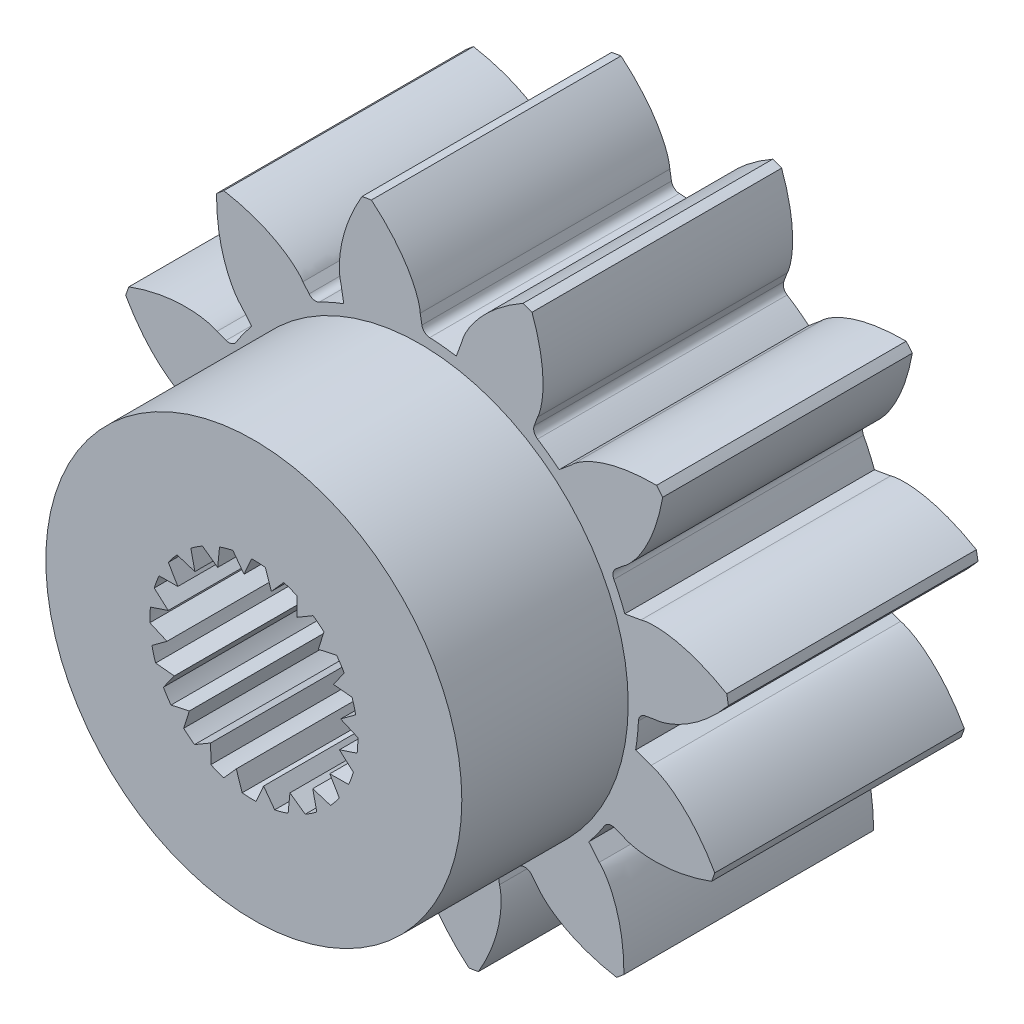
from build123d import *

# Parameters (mm, degrees)
EXTRUDE_9_DEPTH           = 6000
PATTERN_CIRCULAR_4_COUNT  = 12
EXTRUDE_START             = 6000
SKETCH_9_R                = 5000
EXTRUDE_10_DEPTH          = 4000
SKETCH_10_R               = 2500
CUT_EXTRUDE_1_DEPTH       = 10000
EXTRUDE_START_2           = -4000
EXTRUDE_12_DEPTH          = 4000
PATTERN_CIRCULAR_12_COUNT = 20
SKETCH_13_R               = 2500
SKETCH_13_R_2             = 2100
EXTRUDE_13_DEPTH          = 5900
CHAMFER_1_SIZE            = 300


# Read off the part's stored shape, not the designer's step: Бобышка-Вытянуть9
with BuildPart() as part:
    # Бобышка-Вытянуть9 outline → Бобышка-Вытянуть9 (new body)
    with BuildSketch(Plane.XY):
        with BuildLine():
            add(Edge.make_bspline(
                [(5306.192417158, 1906.075026917), (5306.448580551, 1906.165106677), (5306.961668043, 1906.343045565), (5307.99095597, 1906.689845813), (5309.540653432, 1907.192756156), (5311.35337996, 1907.764472804), (5313.95030191, 1908.557747546), (5317.075672181, 1909.479520657), (5320.732777531, 1910.517481963), (5324.924404144, 1911.660215288), (5330.176875618, 1913.040248187), (5336.497938088, 1914.626133361), (5343.894701326, 1916.385727655), (5354.493313319, 1918.761489582), (5366.84000177, 1921.325908382), (5380.945300766, 1924.011039783), (5396.817695636, 1926.748331933), (5412.310969574, 1929.177307208), (5431.718484076, 1931.939359671), (5455.063047063, 1934.843051928), (5485.54471569, 1938.012075463), (5523.195772467, 1940.977861267), (5564.106071411, 1943.156521557), (5608.256997573, 1944.372699431), (5655.937520247, 1944.553223722), (5707.122011738, 1943.489403178), (5761.774342778, 1940.978314208), (5819.848804198, 1936.820805302), (5878.747000314, 1931.176108416), (5938.436248204, 1924.046976876), (5998.884524053, 1915.433286394), (6060.060303893, 1905.332502915), (6127.233340835, 1892.775121857), (6200.296421572, 1877.359660373), (6279.119057582, 1858.67641542), (6363.546359574, 1836.31306456), (6468.344160246, 1805.717375371), (6592.868774888, 1764.968440904), (6736.245826141, 1711.921099134), (6897.34605834, 1644.321879311), (7076.89108329, 1560.25767422), (7213.770397327, 1488.402120254), (7310.317193117, 1433.860426855), (7368.222257541, 1399.750250391)],
                knots=[0, 0, 0, 0, 0, 8.7564e-05, 0.000175127, 0.000350254, 0.000525382, 0.000700509, 0.001050763, 0.001401018, 0.001751272, 0.002101527, 0.002802036, 0.003502545, 0.004203053, 0.005604071, 0.006868344, 0.008132617, 0.009396889, 0.010661162, 0.013189707, 0.015718253, 0.01927867, 0.022839087, 0.026399504, 0.029959921, 0.034653359, 0.039346797, 0.044040235, 0.048733673, 0.053732022, 0.058730371, 0.06372872, 0.068727069, 0.075767527, 0.082807984, 0.089848442, 0.096888899, 0.110969736, 0.125050573, 0.139131407, 0.153212241, 0.174884347, 0.174884347, 0.174884347, 0.174884347, 0.174884347], degree=4))
            Line((5306.192417158, 1906.075026917), (4917.600461427, 1838.397590776))
            ThreePointArc((4917.600461427, 1838.397590776), (-5185.300519011, -821.680307387), (5245.047242409, -227.98996666))
            ThreePointArc((5245.047242409, -227.98996666), (5294.616532272, -104.66268068), (5410.542973109, -39.641189774))
            Line((5410.542973109, -39.641189774), (5638.155724715, 0))
            add(Edge.make_bspline(
                [(5638.155724715, 0), (5638.427258725, 0.001824374), (5638.970291941, 0.007820179), (5640.056219216, 0.029407231), (5641.684691046, 0.080008988), (5643.583966466, 0.154777094), (5646.296166958, 0.286142684), (5649.549142867, 0.475226629), (5653.341825766, 0.734725451), (5657.672978362, 1.076325081), (5663.082738582, 1.553233618), (5669.567765186, 2.197665524), (5677.123882793, 3.042275006), (5687.901636732, 4.389435333), (5700.388322575, 6.150013689), (5714.57088446, 8.391515148), (5730.434132989, 11.181323979), (5745.836350671, 14.133128286), (5765.034948723, 18.094742328), (5787.986673493, 23.254042658), (5817.744985206, 30.57645458), (5854.181857875, 40.513872355), (5893.419973814, 52.29391386), (5935.382531686, 66.075318232), (5980.316750085, 82.024639483), (6028.127958575, 100.32961766), (6078.713553314, 121.169014503), (6131.963189822, 144.714803114), (6185.485291832, 169.938694667), (6239.250031536, 196.827048926), (6293.227228599, 225.369156664), (6347.38635844, 255.556745517), (6406.359144055, 290.083767801), (6469.908956496, 329.291822564), (6537.774483018, 373.522376477), (6609.670561245, 423.111112284), (6697.954681171, 487.334078514), (6801.371661487, 567.781474334), (6918.373397688, 666.1765607), (7047.135298068, 784.258364319), (7187.689728744, 924.071305705), (7292.217863478, 1037.970543174), (7364.641424647, 1121.940227487), (7407.605626076, 1173.617863076)],
                knots=[0, 0, 0, 0, 0, 8.7564e-05, 0.000175127, 0.000350254, 0.000525382, 0.000700509, 0.001050763, 0.001401018, 0.001751272, 0.002101527, 0.002802036, 0.003502545, 0.004203053, 0.005604071, 0.006868344, 0.008132617, 0.009396889, 0.010661162, 0.013189707, 0.015718253, 0.01927867, 0.022839087, 0.026399504, 0.029959921, 0.034653359, 0.039346797, 0.044040235, 0.048733673, 0.053732022, 0.058730371, 0.06372872, 0.068727069, 0.075767527, 0.082807984, 0.089848442, 0.096888899, 0.110969736, 0.125050573, 0.139131407, 0.153212241, 0.174884347, 0.174884347, 0.174884347, 0.174884347, 0.174884347], degree=4))
            ThreePointArc((7407.605626076, 1173.617863076), (7388.779085594, 1286.834730757), (7368.222257541, 1399.750250391))
        make_face()
    extrude_9 = extrude(amount=EXTRUDE_9_DEPTH)

    # Круговой массив4: Бобышка-Вытянуть9 ×12 about axis
    pattern_circular_4_axis = Axis((0, 0, 6000), (0, 0, -1))
    for i in range(1, PATTERN_CIRCULAR_4_COUNT):
        add(extrude_9.rotate(pattern_circular_4_axis, i * 360 / PATTERN_CIRCULAR_4_COUNT))

    # Эскиз9 → Бобышка-Вытянуть10 (add)
    with BuildSketch(Plane.XY.offset(EXTRUDE_START)):
        Circle(SKETCH_9_R)
    extrude(amount=EXTRUDE_10_DEPTH)

    # Эскиз10 → Вырез-Вытянуть1 (cut)
    with BuildSketch(Plane.XY):
        Circle(SKETCH_10_R)
    extrude(amount=CUT_EXTRUDE_1_DEPTH, mode=Mode.SUBTRACT)

    # Эскиз12 → Бобышка-Вытянуть12 (add)
    with BuildSketch(Plane.XY.offset(10000).offset(EXTRUDE_START_2)):
        with BuildLine():
            Line((-1234.473416519, 2173.953859655), (-868.338290869, 1912.063966663))
            Line((-868.338290869, 1912.063966663), (-824.602553369, 2360.091233189))
            ThreePointArc((-824.602553369, 2360.091233189), (-1033.736060559, 2276.26662698), (-1234.473416519, 2173.953859655))
        make_face()
    extrude_12 = extrude(amount=EXTRUDE_12_DEPTH)

    # Круговой массив12: Бобышка-Вытянуть12 ×20 about axis
    pattern_circular_12_axis = Axis((0, 0, 0), (0, 0, 1))
    for i in range(1, PATTERN_CIRCULAR_12_COUNT):
        add(extrude_12.rotate(pattern_circular_12_axis, i * 360 / PATTERN_CIRCULAR_12_COUNT))

    # Эскиз13 → Бобышка-Вытянуть13 (add)
    with BuildSketch(Plane(origin=(0, 0, 0), x_dir=(-1, 0, 0), z_dir=(0, 0, -1))):
        Circle(SKETCH_13_R)
        Circle(SKETCH_13_R_2, mode=Mode.SUBTRACT)
    extrude(amount=-EXTRUDE_13_DEPTH)

    # Фаска1
    chamfer_1_edges = [part.edges().sort_by_distance(p)[0] for p in [
        (2100, 0, 5900),
    ]]
    chamfer(chamfer_1_edges, length=CHAMFER_1_SIZE)


solid = part.part
